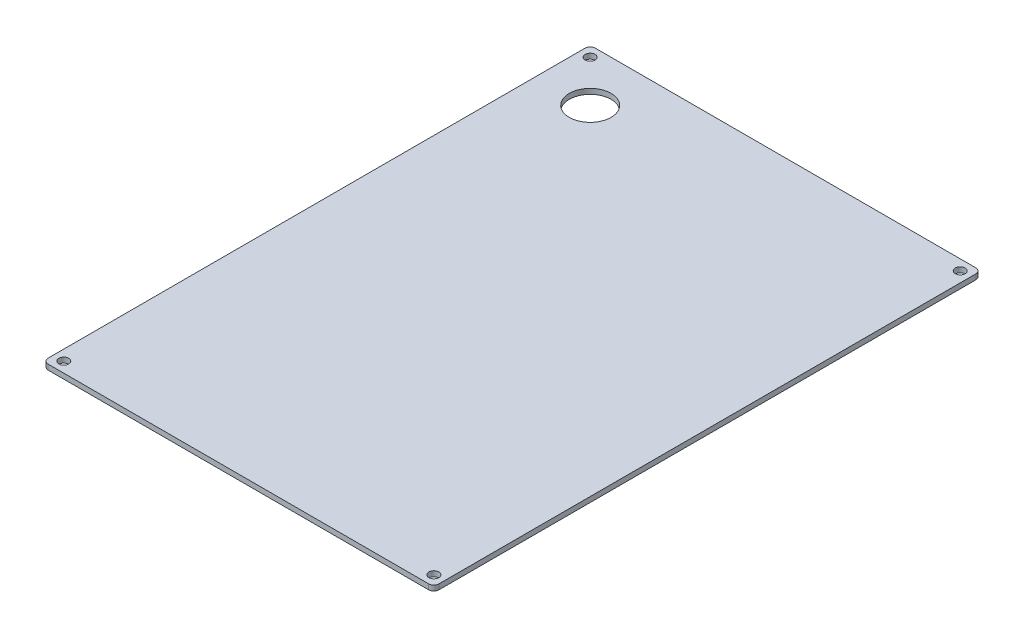
from build123d import *

# Parameters (mm, degrees)
SKETCH1_W           = 150
SKETCH1_H           = 210
BOSS_EXTRUDE1_DEPTH = 2
SKETCH2_R           = 1.9
SKETCH2_R_2         = 8
CUT_EXTRUDE1_DEPTH  = 10
FILLET1_R           = 2


with BuildPart() as part:
    # Sketch1 → Boss-Extrude1 (new body)
    with BuildSketch(Plane(origin=(0, 0, 0), x_dir=(1, 0, 0), z_dir=(0, 1, 0))):
        with Locations((75, 105)):
            Rectangle(SKETCH1_W, SKETCH1_H)
    extrude(amount=BOSS_EXTRUDE1_DEPTH)

    # Sketch2 → Cut-Extrude1 (cut)
    with BuildSketch(Plane(origin=(0, 2, 0), x_dir=(1, 0, 0), z_dir=(0, 1, 0))):
        with Locations((4, 206)):
            Circle(SKETCH2_R)
        with Locations((146, 206)):
            Circle(SKETCH2_R)
        with Locations((146, 4)):
            Circle(SKETCH2_R)
        with Locations((4, 4)):
            Circle(SKETCH2_R)
        with Locations((20, 190)):
            Circle(SKETCH2_R_2)
    extrude(amount=-CUT_EXTRUDE1_DEPTH, mode=Mode.SUBTRACT)

    # Fillet1
    fillet1_edges = [part.edges().sort_by_distance(p)[0] for p in [
        (0, 1, 0),
        (150, 1, 0),
        (150, 1, -210),
        (0, 1, -210),
    ]]
    fillet(fillet1_edges, radius=FILLET1_R)


solid = part.part
